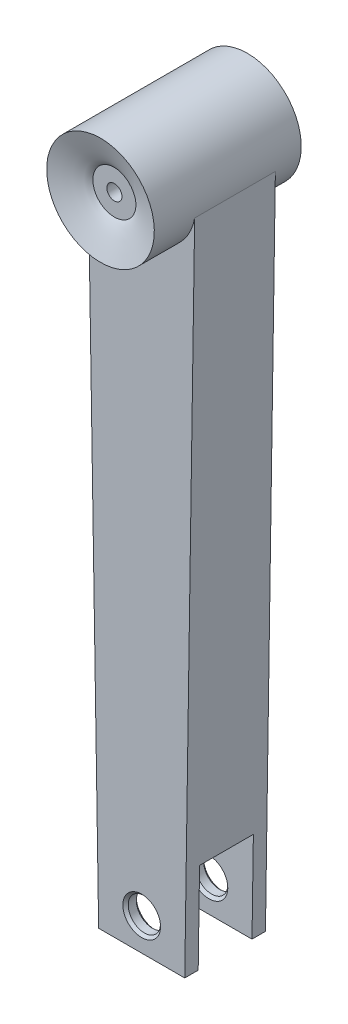
from build123d import *

# Parameters (mm, degrees)
SKETCH_1_R               = 10
EXTRUDE_1_DEPTH          = 28
EXTRUDE_START            = -15
EXTRUDE_2_DEPTH          = 15
CUT_EXTRUDE_2_DEPTH      = 128.720701533
CUT_EXTRUDE_2_DEPTH_BACK = 128.720701533
SKETCH_3_R               = 4
CUT_EXTRUDE_3_DEPTH      = 129.412129246
CUT_EXTRUDE_3_DEPTH_BACK = 129.412129246
SKETCH_7_W               = 10
SKETCH_7_H               = 22
CUT_EXTRUDE_4_DEPTH      = 128.428989534
CUT_EXTRUDE_4_DEPTH_BACK = 128.428989534
SKETCH_8_R               = 3
EXTRUDE_START_2          = -3
SKETCH_9_R               = 4
EXTRUDE_3_DEPTH          = 3
SKETCH_10_R              = 1.4
CUT_EXTRUDE_5_DEPTH      = 128.267326381
CHAMFER_1_SIZE           = 0.5


with BuildPart() as part:
    # 草图1 → 凸台-拉伸1 (new body)
    with BuildSketch(Plane.XY):
        Circle(SKETCH_1_R)
    extrude(amount=EXTRUDE_1_DEPTH)

    # 草图2 → 凸台-拉伸2 (add)
    with BuildSketch(Plane.XY.offset(20).offset(EXTRUDE_START)):
        with BuildLine():
            Line((-9.998718605, -0.160082009), (-8, -125))
            Line((-8, -125), (8, -125))
            Line((8, -125), (9.842868133, -1.765770913))
            ThreePointArc((9.842868133, -1.765770913), (-0.806617354, -9.967415334), (-9.998718605, -0.160082009))
        make_face()
    extrude(amount=EXTRUDE_2_DEPTH)

    # 草图3 → 切除-拉伸2 (cut, two sides: drawn at the far end of the back side and taken through both)
    with BuildSketch(Plane(origin=(0, 0, 3.76), x_dir=(-1, 0, 0), z_dir=(0, 0, -1)).offset(-CUT_EXTRUDE_2_DEPTH_BACK)):
        Circle(SKETCH_3_R)
    extrude(amount=CUT_EXTRUDE_2_DEPTH + CUT_EXTRUDE_2_DEPTH_BACK, mode=Mode.SUBTRACT)

    # 切除-放样2: read off the stored shape, not the designer's step
    # 切除-放样2: loft between two sections, ruled curve by curve
    loft_2_from = [
        Edge.make_bspline([(3.291276386, -2.27321353, 3.76), (-1.255150675, -8.855766301, 3.76), (-7.837703446, -4.309339241, 3.76), (-3.291276386, 2.27321353, 3.76), (1.255150675, 8.855766301, 3.76), (7.837703446, 4.309339241, 3.76), (3.291276386, -2.27321353, 3.76)], [0, 0, 0, 0, 0.5, 0.5, 0.5, 1, 1, 1, 1], 3, [1, 0.333333333, 0.333333333, 1, 0.333333333, 0.333333333, 1]),
    ]
    loft_2_to = [
        Edge.make_bspline([(6.471228023, 8.895122702, 0), (24.261473426, -4.047333344, 0), (11.319017381, -21.837578747, 0), (-6.471228023, -8.895122702, 0), (-24.261473426, 4.047333344, 0), (-11.319017381, 21.837578747, 0), (6.471228023, 8.895122702, 0)], [0, 0, 0, 0, 0.5, 0.5, 0.5, 1, 1, 1, 1], 3, [1, 0.333333333, 0.333333333, 1, 0.333333333, 0.333333333, 1]),
    ]
    loft_2 = Solid(Shell([*[Face.make_surface_from_curves(loft_2_from[k], loft_2_to[k]) for k in range(1)], Face(Wire(loft_2_from)), Face(Wire(loft_2_to))]))
    add(loft_2, mode=Mode.SUBTRACT)

    # 镜向1: 切除-放样2 across plane
    add(loft_2.mirror(Plane(origin=(0, 0, 14), x_dir=(1, 0, 0), z_dir=(0, 0, -1))), mode=Mode.SUBTRACT)

    # 草图7 → 切除-拉伸3 (cut, two sides: drawn at the far end of the back side and taken through both)
    with BuildSketch(Plane(origin=(0, 0, 0), x_dir=(0, 0, -1), z_dir=(1, 0, 0)).offset(-CUT_EXTRUDE_3_DEPTH_BACK)):
        with Locations((-12.5, -119)):
            Rectangle(SKETCH_7_W, SKETCH_7_H)
    extrude(amount=CUT_EXTRUDE_3_DEPTH + CUT_EXTRUDE_3_DEPTH_BACK, mode=Mode.SUBTRACT)

    # 草图8 → 切除-拉伸4 (cut, two sides: drawn at the far end of the back side and taken through both)
    with BuildSketch(Plane(origin=(0, 0, 5), x_dir=(-1, 0, 0), z_dir=(0, 0, -1)).offset(-CUT_EXTRUDE_4_DEPTH_BACK)):
        with Locations((0, -119)):
            Circle(SKETCH_8_R)
    extrude(amount=CUT_EXTRUDE_4_DEPTH + CUT_EXTRUDE_4_DEPTH_BACK, mode=Mode.SUBTRACT)

    # 草图9 → 凸台-拉伸3 (add)
    with BuildSketch(Plane.XY.offset(25.072168523).offset(EXTRUDE_START_2)):
        with Locations(Location((0, 0, 0), (0, 0, 180))):
            Circle(SKETCH_9_R)
    extrude(amount=EXTRUDE_3_DEPTH)

    # 草图10 → 切除-拉伸5 (cut, through all)
    with BuildSketch(Plane(origin=(0, 0, 22.072168523), x_dir=(-1, 0, 0), z_dir=(0, 0, -1))):
        Circle(SKETCH_10_R)
    extrude(amount=-CUT_EXTRUDE_5_DEPTH, mode=Mode.SUBTRACT)

    # 倒角1
    chamfer_1_edges = [part.edges().sort_by_distance(p)[0] for p in [
        (3, -119, 7.5),
        (3, -119, 5),
        (3, -119, 20),
        (3, -119, 17.5),
    ]]
    chamfer(chamfer_1_edges, length=CHAMFER_1_SIZE)


solid = part.part
